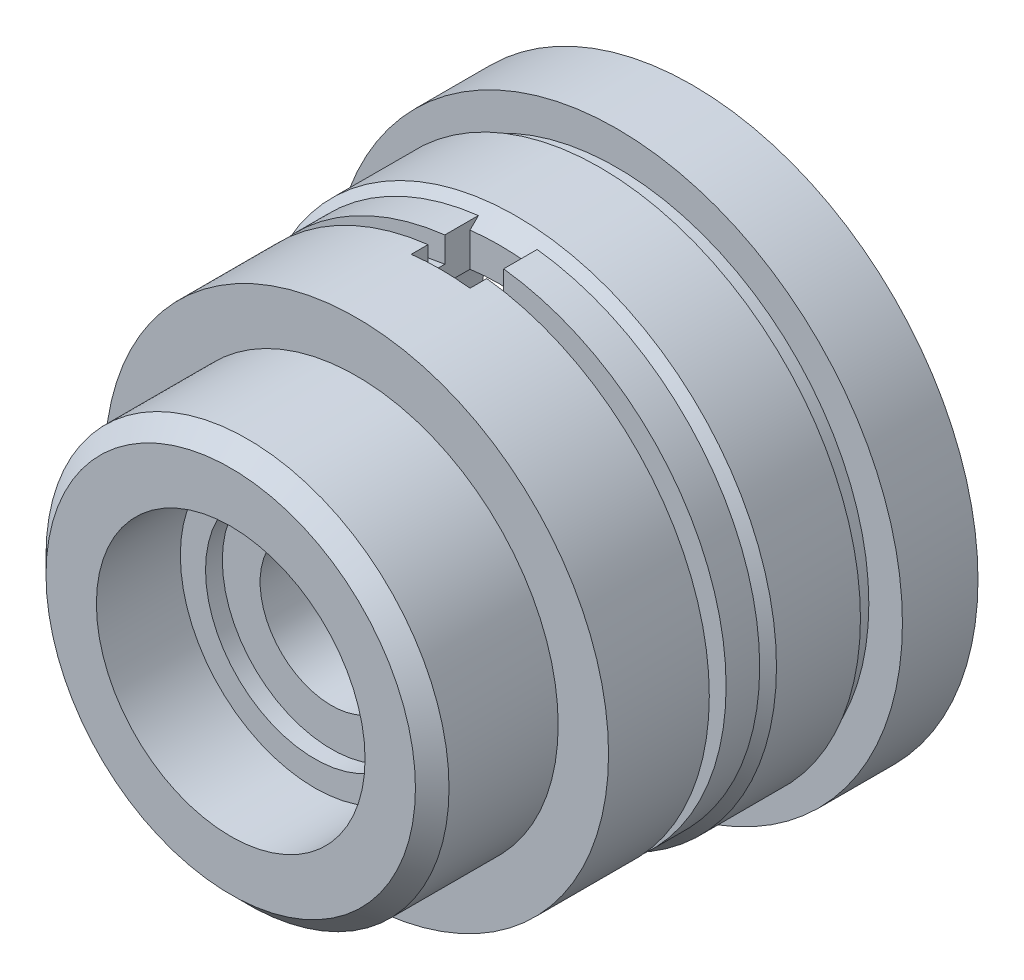
from build123d import *

# Parameters (mm, degrees)
SKETCH1_R                           = 17
BOSS_EXTRUDE1_DEPTH                 = 4.5
SKETCH2_R                           = 15
BOSS_EXTRUDE2_DEPTH                 = 1
SKETCH3_R                           = 15.5
BOSS_EXTRUDE3_DEPTH                 = 6
SKETCH7_R                           = 15
BOSS_EXTRUDE4_DEPTH                 = 8.5
SKETCH8_R                           = 12
BOSS_EXTRUDE5_DEPTH                 = 7.5
CUT_EXTRUDE1_REACH                  = 38.527
CUT_EXTRUDE1_END_RADIUS             = 15
SKETCH9_W                           = 3.5
SKETCH9_H                           = 3.5
CUT_EXTRUDE1_DIRECTION_2_REACH      = 38.527
CUT_EXTRUDE1_DIRECTION_2_END_RADIUS = 15
CHAMFER1_SIZE                       = 1
CHAMFER2_SIZE                       = 1
SKETCH10_R                          = 12.5
CUT_EXTRUDE2_DEPTH                  = 18
SKETCH11_R                          = 8
CUT_EXTRUDE3_DEPTH                  = 5
SKETCH12_R                          = 6.5
CUT_EXTRUDE4_DEPTH                  = 1
SKETCH13_R                          = 4.25
CUT_EXTRUDE5_DEPTH                  = 3.5
SKETCH17_W                          = 1
SKETCH17_H                          = 1.5
F_2_0_2_DIAMETER_HOLE1_D            = 2
F_2_0_2_DIAMETER_HOLE1_DEPTH        = 2.5
F_2_0_2_DIAMETER_HOLE1_TIP          = 0.600860619


with BuildPart() as part:
    # Sketch1 → Boss-Extrude1 (new body)
    with BuildSketch(Plane.XY):
        Circle(SKETCH1_R)
    extrude(amount=BOSS_EXTRUDE1_DEPTH)

    # Sketch2 → Boss-Extrude2 (add)
    with BuildSketch(Plane.XY.offset(4.5)):
        Circle(SKETCH2_R)
    extrude(amount=BOSS_EXTRUDE2_DEPTH)

    # Sketch3 → Boss-Extrude3 (add)
    with BuildSketch(Plane.XY.offset(5.5)):
        Circle(SKETCH3_R)
    extrude(amount=BOSS_EXTRUDE3_DEPTH)

    # Sketch7 → Boss-Extrude4 (add)
    with BuildSketch(Plane.XY.offset(11.5)):
        Circle(SKETCH7_R)
    extrude(amount=BOSS_EXTRUDE4_DEPTH)

    # Sketch8 → Boss-Extrude5 (add)
    with BuildSketch(Plane.XY.offset(20)):
        Circle(SKETCH8_R)
    extrude(amount=BOSS_EXTRUDE5_DEPTH)

    # Cut-Extrude1: up to this cylinder (the profile starts inside it)
    cut_extrude1_end = Plane(origin=(0, 0, 13.25), z_dir=(0, 0, -1)) * Cylinder(CUT_EXTRUDE1_END_RADIUS, 108.054, mode=Mode.PRIVATE)
    # Sketch9 → Cut-Extrude1 (cut, up to the surface)
    with BuildSketch(Plane(origin=(0, 0, 0), x_dir=(1, 0, 0), z_dir=(0, 1, 0)), mode=Mode.PRIVATE) as cut_extrude1_sk1:
        with Locations((0, -13.25)):
            Rectangle(SKETCH9_W, SKETCH9_H)
    cut_extrude1_tool1 = extrude(cut_extrude1_sk1.sketch, amount=-CUT_EXTRUDE1_REACH, mode=Mode.PRIVATE) & cut_extrude1_end
    add(cut_extrude1_tool1.solids().sort_by_distance((0, 0, 13.25))[0], mode=Mode.SUBTRACT)

    # Cut-Extrude1 direction 2: up to this cylinder (the profile starts inside it)
    cut_extrude1_direction_2_end = Plane(origin=(0, 0, 13.25), z_dir=(0, 0, -1)) * Cylinder(CUT_EXTRUDE1_DIRECTION_2_END_RADIUS, 108.054, mode=Mode.PRIVATE)
    # Sketch9 → Cut-Extrude1 direction 2 (cut, up to the surface)
    with BuildSketch(Plane(origin=(0, 0, 0), x_dir=(1, 0, 0), z_dir=(0, 1, 0)), mode=Mode.PRIVATE) as cut_extrude1_direction_2_sk1:
        with Locations((0, -13.25)):
            Rectangle(SKETCH9_W, SKETCH9_H)
    cut_extrude1_direction_2_tool1 = extrude(cut_extrude1_direction_2_sk1.sketch, amount=CUT_EXTRUDE1_DIRECTION_2_REACH, mode=Mode.PRIVATE) & cut_extrude1_direction_2_end
    add(cut_extrude1_direction_2_tool1.solids().sort_by_distance((0, 0, 13.25))[0], mode=Mode.SUBTRACT)

    # Chamfer1
    # the kernel refuses this chamfer: 1 mm, written as the material it takes off along each edge
    with BuildSketch(Plane(origin=(0, 0, 11.5), x_dir=(1, 0, 0), z_dir=(0, -1, 0))) as chamfer1_piece_1_section:
        Polygon((15.5, -CHAMFER1_SIZE), (15.5 - CHAMFER1_SIZE, 0), (15.5, 0), align=None)
    chamfer1_piece_1 = revolve(axis=Axis((0, 0, 11.5), (0, 0, 1)), mode=Mode.PRIVATE)
    chamfer1_piece_1 = chamfer1_piece_1 - Plane(origin=(0, 0, 10.7680681), x_dir=(1, 0, 0), z_dir=(0, 0, -1)) * Cylinder(15, 62, mode=Mode.PRIVATE)
    add(chamfer1_piece_1, mode=Mode.SUBTRACT)
    with BuildSketch(Plane(origin=(0, 0, 11.5), x_dir=(1, 0, 0), z_dir=(0, -1, 0))) as chamfer1_piece_2_section:
        Polygon((15.5, -CHAMFER1_SIZE), (15.5 - CHAMFER1_SIZE, 0), (15.5, 0), align=None)
    chamfer1_piece_2 = revolve(axis=Axis((0, 0, 11.5), (0, 0, 1)), mode=Mode.PRIVATE)
    chamfer1_piece_2 = split(chamfer1_piece_2, bisect_by=Plane(origin=(-1.75, 14.798779875, 11.333335543), z_dir=(1, 0, 0)), keep=Keep.TOP, mode=Mode.PRIVATE)
    chamfer1_piece_2 = split(chamfer1_piece_2, bisect_by=Plane(origin=(1.75, 14.798779875, 11.333335543), z_dir=(-1, 0, 0)), keep=Keep.TOP, mode=Mode.PRIVATE)
    add(chamfer1_piece_2, mode=Mode.SUBTRACT)

    # Chamfer2
    chamfer2_edges = [part.edges().sort_by_distance(p)[0] for p in [
        (-12, 0, 27.5),
    ]]
    chamfer(chamfer2_edges, length=CHAMFER2_SIZE)

    # Sketch10 → Cut-Extrude2 (cut)
    with BuildSketch(Plane(origin=(0, 0, 0), x_dir=(-1, 0, 0), z_dir=(0, 0, -1))):
        Circle(SKETCH10_R)
    extrude(amount=-CUT_EXTRUDE2_DEPTH, mode=Mode.SUBTRACT)

    # Sketch11 → Cut-Extrude3 (cut)
    with BuildSketch(Plane.XY.offset(27.5)):
        Circle(SKETCH11_R)
    extrude(amount=-CUT_EXTRUDE3_DEPTH, mode=Mode.SUBTRACT)

    # Sketch12 → Cut-Extrude4 (cut)
    with BuildSketch(Plane.XY.offset(22.5)):
        Circle(SKETCH12_R)
    extrude(amount=-CUT_EXTRUDE4_DEPTH, mode=Mode.SUBTRACT)

    # Sketch13 → Cut-Extrude5 (cut)
    with BuildSketch(Plane.XY.offset(21.5)):
        Circle(SKETCH13_R)
    extrude(amount=-CUT_EXTRUDE5_DEPTH, mode=Mode.SUBTRACT)

    # Sketch6 → Cut-Revolve4 (revolve, cut)
    with BuildSketch(Plane(origin=(0, 0, 0), x_dir=(0, 0, -1), z_dir=(1, 0, 0))):
        with BuildLine():
            Line((0, 14.5), (0, 15.6))
            Line((0, 15.6), (-1.560883383, 14.671907178))
            ThreePointArc((-1.560883383, 14.671907178), (-1.632511647, 14.598886259), (-1.658668305, 14.5))
            Line((-1.658668305, 14.5), (0, 14.5))
        make_face()
    revolve(axis=Axis((0, 14.5, 1.658668305), (0, 0, -1)), mode=Mode.SUBTRACT)

    # Sketch17 → Cut-Revolve5 (revolve, cut)
    with BuildSketch(Plane(origin=(0, 0, 0), x_dir=(0, 0, -1), z_dir=(1, 0, 0)), mode=Mode.PRIVATE) as cut_revolve5_sk:
        with Locations((-13.5, 14.25)):
            Rectangle(SKETCH17_W, SKETCH17_H)
    revolve(cut_revolve5_sk.sketch.rotate(Axis((0, 0, 0), (0, 0, 1)), 6.699765178), axis=Axis((0, 0, 0), (0, 0, 1)), mode=Mode.SUBTRACT)

    # Ø2.0 (2) Diameter Hole1
    with Locations(Plane(origin=(0, 0, 18), x_dir=(-1, 0, 0), z_dir=(0, 0, -1))):
        with Locations((0, 8.5), (7.361215932, -4.25), (-7.361215932, -4.25)):
            Hole(F_2_0_2_DIAMETER_HOLE1_D / 2, depth=F_2_0_2_DIAMETER_HOLE1_DEPTH)
            with Locations((0, 0, -(F_2_0_2_DIAMETER_HOLE1_DEPTH + F_2_0_2_DIAMETER_HOLE1_TIP / 2))):  # 118° drill point
                Cone(0, F_2_0_2_DIAMETER_HOLE1_D / 2, F_2_0_2_DIAMETER_HOLE1_TIP, mode=Mode.SUBTRACT)


solid = part.part
